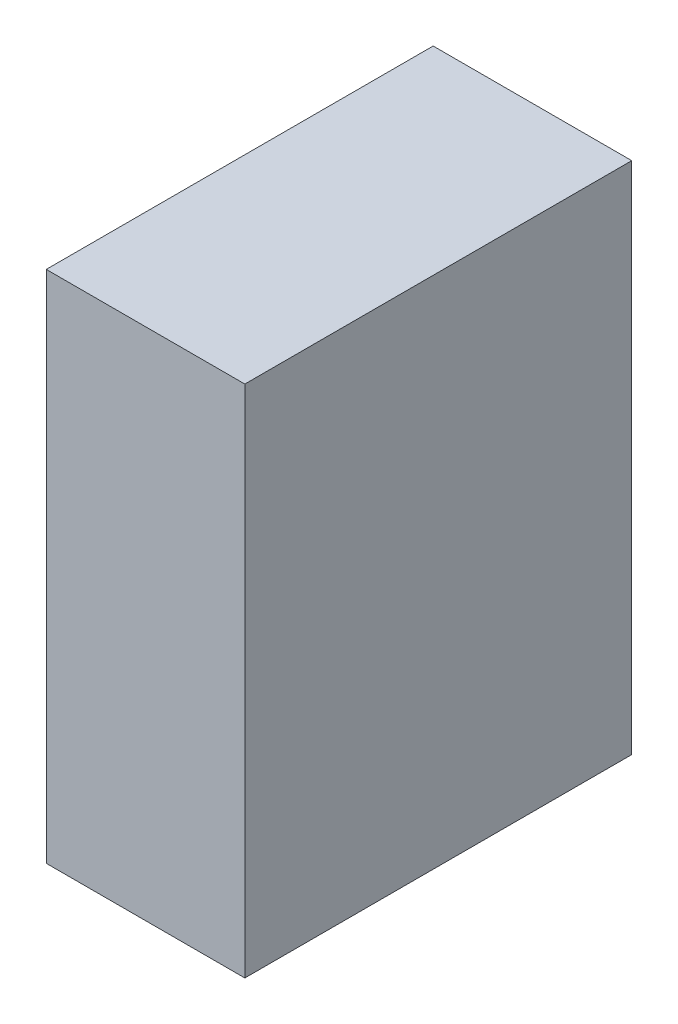
from build123d import *

# Parameters (mm, degrees)
BOSS_EXTRUDE1_DEPTH      = 50.9905
BOSS_EXTRUDE1_DEPTH_BACK = 50.9905
SKETCH1_W                = 39.37
SKETCH1_H                = 76.708


with BuildPart() as part:
    # Sketch1 → Boss-Extrude1 (new, two sides: drawn at the far end of the back side and taken through both)
    with BuildSketch(Plane(origin=(0, 0, 0), x_dir=(1, 0, 0), z_dir=(0, 1, 0)).offset(-BOSS_EXTRUDE1_DEPTH_BACK)):
        Rectangle(SKETCH1_W, SKETCH1_H)
    extrude(amount=BOSS_EXTRUDE1_DEPTH + BOSS_EXTRUDE1_DEPTH_BACK)


solid = part.part
